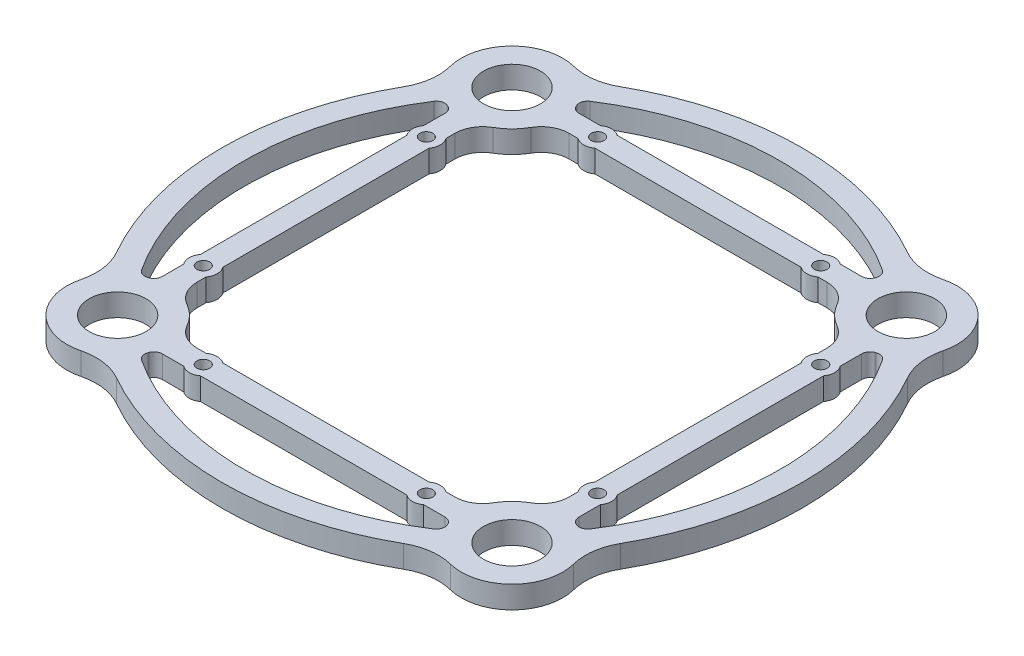
from build123d import *

# Parameters (mm, degrees)
SKETCH1_R           = 5.1
BOSS_EXTRUDE1_DEPTH = 4
BOSS_EXTRUDE2_START = -4
BOSS_EXTRUDE2_DEPTH = 4
SKETCH3_R           = 2.5
BOSS_EXTRUDE3_DEPTH = 4
SKETCH4_R           = 1.15
CUT_EXTRUDE1_DEPTH  = 4
FILLET1_R           = 10
FILLET2_R           = 1.5
FILLET3_R           = 5


with BuildPart() as part:
    # Sketch1 → Boss-Extrude1 (new body)
    with BuildSketch(Plane(origin=(0, 0, 0), x_dir=(1, 0, 0), z_dir=(0, 1, 0))):
        with BuildLine():
            ThreePointArc((42.589636172, -29.834927363), (52, 0), (42.589636172, 29.834927363))
            ThreePointArc((42.589636172, 29.834927363), (41.790010768, 41.790010768), (29.834927363, 42.589636172))
            ThreePointArc((29.834927363, 42.589636172), (0, 52), (-29.834927363, 42.589636172))
            ThreePointArc((-29.834927363, 42.589636172), (-41.790010768, 41.790010768), (-42.589636172, 29.834927363))
            ThreePointArc((-42.589636172, 29.834927363), (-52, 0), (-42.589636172, -29.834927363))
            ThreePointArc((-42.589636172, -29.834927363), (-41.790010768, -41.790010768), (-29.834927363, -42.589636172))
            ThreePointArc((-29.834927363, -42.589636172), (0, -52), (29.834927363, -42.589636172))
            ThreePointArc((29.834927363, -42.589636172), (41.790010768, -41.790010768), (42.589636172, -29.834927363))
        make_face()
        with BuildLine():
            ThreePointArc((39.509068859, -27.258640426), (28.920667351, -28.920667351), (27.258640426, -39.509068859))
            ThreePointArc((27.258640426, -39.509068859), (0, -48), (-27.258640426, -39.509068859))
            ThreePointArc((-27.258640426, -39.509068859), (-28.920667351, -28.920667351), (-39.509068859, -27.258640426))
            ThreePointArc((-39.509068859, -27.258640426), (-48, 0), (-39.509068859, 27.258640426))
            ThreePointArc((-39.509068859, 27.258640426), (-28.920667351, 28.920667351), (-27.258640426, 39.509068859))
            ThreePointArc((-27.258640426, 39.509068859), (0, 48), (27.258640426, 39.509068859))
            ThreePointArc((27.258640426, 39.509068859), (28.920667351, 28.920667351), (39.509068859, 27.258640426))
            ThreePointArc((39.509068859, 27.258640426), (48, 0), (39.509068859, -27.258640426))
        make_face(mode=Mode.SUBTRACT)
        with Locations((35.355339059, -35.355339059)):
            Circle(SKETCH1_R, mode=Mode.SUBTRACT)
        with Locations((35.355339059, 35.355339059)):
            Circle(SKETCH1_R, mode=Mode.SUBTRACT)
        with Locations((-35.355339059, -35.355339059)):
            Circle(SKETCH1_R, mode=Mode.SUBTRACT)
        with Locations((-35.355339059, 35.355339059)):
            Circle(SKETCH1_R, mode=Mode.SUBTRACT)
    extrude(amount=BOSS_EXTRUDE1_DEPTH)

    # Sketch2 → Boss-Extrude2 (add)
    with BuildSketch(Plane(origin=(0, 4, 0), x_dir=(1, 0, 0), z_dir=(0, 1, 0)).offset(BOSS_EXTRUDE2_START)):
        with BuildLine():
            Line((-33.355339059, -26.477839411), (-33.355339059, 26.477839411))
            ThreePointArc((-33.355339059, 26.477839411), (-35.355339059, 26.255339059), (-37.355339059, 26.477839411))
            Line((-37.355339059, 26.477839411), (-37.355339059, -26.477839411))
            ThreePointArc((-37.355339059, -26.477839411), (-35.355339059, -26.255339059), (-33.355339059, -26.477839411))
        make_face()
        with BuildLine():
            ThreePointArc((-26.477839411, 37.355339059), (-26.255339059, 35.355339059), (-26.477839411, 33.355339059))
            Line((-26.477839411, 33.355339059), (26.477839411, 33.355339059))
            ThreePointArc((26.477839411, 33.355339059), (26.255339059, 35.355339059), (26.477839411, 37.355339059))
            Line((26.477839411, 37.355339059), (-26.477839411, 37.355339059))
        make_face()
        with BuildLine():
            Line((26.477839411, -33.355339059), (-26.477839411, -33.355339059))
            ThreePointArc((-26.477839411, -33.355339059), (-26.255339059, -35.355339059), (-26.477839411, -37.355339059))
            Line((-26.477839411, -37.355339059), (26.477839411, -37.355339059))
            ThreePointArc((26.477839411, -37.355339059), (26.255339059, -35.355339059), (26.477839411, -33.355339059))
        make_face()
        with BuildLine():
            ThreePointArc((37.355339059, 26.477839411), (35.355339059, 26.255339059), (33.355339059, 26.477839411))
            Line((33.355339059, 26.477839411), (33.355339059, -26.477839411))
            ThreePointArc((33.355339059, -26.477839411), (35.355339059, -26.255339059), (37.355339059, -26.477839411))
            Line((37.355339059, -26.477839411), (37.355339059, 26.477839411))
        make_face()
    extrude(amount=BOSS_EXTRUDE2_DEPTH)

    # Sketch3 → Boss-Extrude3 (add)
    with BuildSketch(Plane(origin=(0, 4, 0), x_dir=(1, 0, 0), z_dir=(0, 1, 0))):
        with Locations((-20, 35.355339059)):
            Circle(SKETCH3_R)
        with Locations((20, 35.355339059)):
            Circle(SKETCH3_R)
        with Locations((35.355339059, 20)):
            Circle(SKETCH3_R)
        with Locations((35.355339059, -20)):
            Circle(SKETCH3_R)
        with Locations((-35.355339059, -20)):
            Circle(SKETCH3_R)
        with Locations((-35.355339059, 20)):
            Circle(SKETCH3_R)
        with Locations((-20, -35.355339059)):
            Circle(SKETCH3_R)
        with Locations((20, -35.355339059)):
            Circle(SKETCH3_R)
    extrude(amount=-BOSS_EXTRUDE3_DEPTH)

    # Sketch4 → Cut-Extrude1 (cut)
    with BuildSketch(Plane(origin=(0, 4, 0), x_dir=(1, 0, 0), z_dir=(0, 1, 0))):
        with Locations((-20, 35.355339059)):
            Circle(SKETCH4_R)
        with Locations((20, 35.355339059)):
            Circle(SKETCH4_R)
        with Locations((-35.355339059, 20)):
            Circle(SKETCH4_R)
        with Locations((-35.355339059, -20)):
            Circle(SKETCH4_R)
        with Locations((-20, -35.355339059)):
            Circle(SKETCH4_R)
        with Locations((20, -35.355339059)):
            Circle(SKETCH4_R)
        with Locations((35.355339059, -20)):
            Circle(SKETCH4_R)
        with Locations((35.355339059, 20)):
            Circle(SKETCH4_R)
    extrude(amount=-CUT_EXTRUDE1_DEPTH, mode=Mode.SUBTRACT)

    # Fillet1
    fillet1_edges = [part.edges().sort_by_distance(p)[0] for p in [
        (29.834927363, 2, 42.589636172),
        (42.589636172, 2, 29.834927363),
        (42.589636172, 2, -29.834927363),
        (29.834927363, 2, -42.589636172),
        (-29.834927363, 2, -42.589636172),
        (-42.589636172, 2, -29.834927363),
        (-42.589636172, 2, 29.834927363),
        (-29.834927363, 2, 42.589636172),
    ]]
    fillet(fillet1_edges, radius=FILLET1_R)

    # Fillet2
    fillet2_edges = [part.edges().sort_by_distance(p)[0] for p in [
        (-39.509068859, 2, 27.258640426),
        (-37.355339059, 2, 26.477839411),
        (-39.509068859, 2, -27.258640426),
        (-37.355339059, 2, -26.477839411),
        (27.258640426, 2, -39.509068859),
        (26.477839411, 2, -37.355339059),
        (-26.477839411, 2, -37.355339059),
        (-27.258640426, 2, -39.509068859),
        (39.509068859, 2, 27.258640426),
        (37.355339059, 2, 26.477839411),
        (37.355339059, 2, -26.477839411),
        (39.509068859, 2, -27.258640426),
        (27.258640426, 2, 39.509068859),
        (26.477839411, 2, 37.355339059),
        (-27.258640426, 2, 39.509068859),
        (-26.477839411, 2, 37.355339059),
    ]]
    fillet(fillet2_edges, radius=FILLET2_R)

    # Fillet3
    fillet3_edges = [part.edges().sort_by_distance(p)[0] for p in [
        (-26.477839411, 2, -33.355339059),
        (-33.355339059, 2, -26.477839411),
        (-33.355339059, 2, 26.477839411),
        (-26.477839411, 2, 33.355339059),
        (26.477839411, 2, 33.355339059),
        (33.355339059, 2, 26.477839411),
        (26.477839411, 2, -33.355339059),
        (33.355339059, 2, -26.477839411),
    ]]
    fillet(fillet3_edges, radius=FILLET3_R)


solid = part.part
